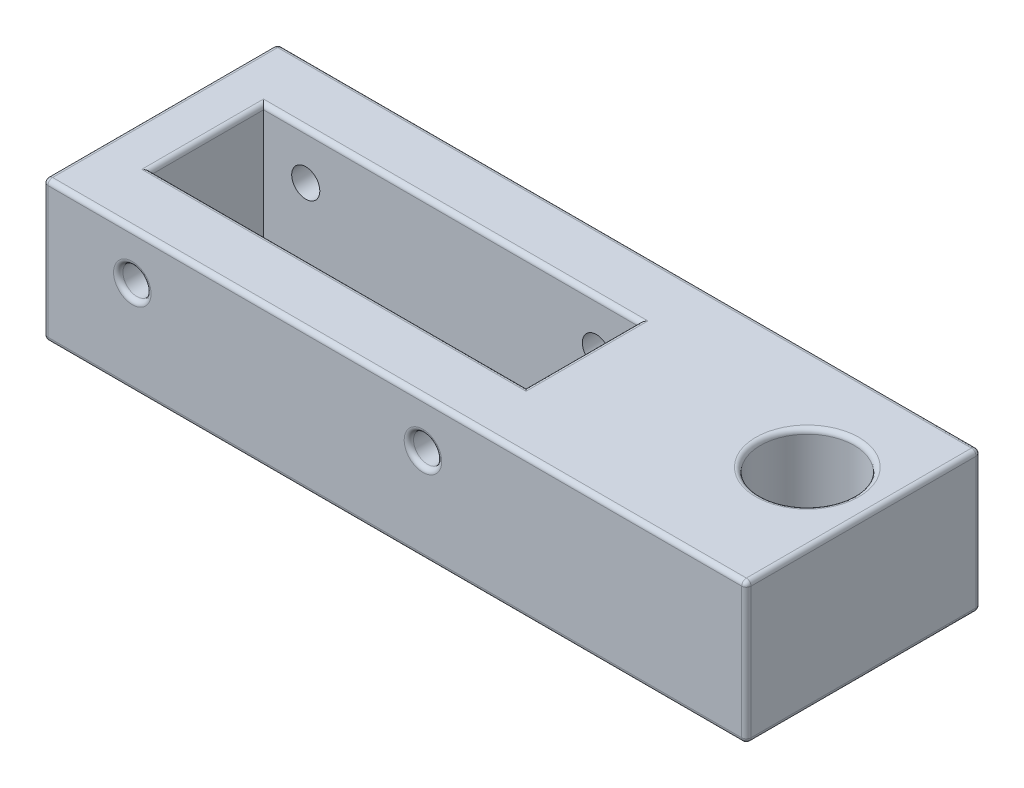
from build123d import *

# Parameters (mm, degrees)
SKETCH1_W               = 1500
SKETCH1_H               = 500
BOSS_EXTRUDE6_DEPTH     = 300
CUT_EXTRUDE3_DEPTH      = 951
CUT_EXTRUDE3_DEPTH_BACK = 951
SKETCH4_R               = 30
FILLET1_R               = 10
FILLET3_R               = 10
FILLET4_R               = 10
FILLET5_R               = 10
FILLET6_R               = 10
FILLET7_R               = 10
CUT_EXTRUDE6_DEPTH      = 846.576726294
CUT_EXTRUDE6_DEPTH_BACK = 846.576726294
SKETCH6_R               = 100
SKETCH6_W               = 800
SKETCH6_H               = 240
FILLET8_R               = 10
FILLET9_R               = 10


with BuildPart() as part:
    # Sketch1 → Boss-Extrude6 (new body)
    with BuildSketch(Plane(origin=(0, 0, 0), x_dir=(1, 0, 0), z_dir=(0, 1, 0))):
        Rectangle(SKETCH1_W, SKETCH1_H)
    extrude(amount=BOSS_EXTRUDE6_DEPTH)

    # Sketch4 → Cut-Extrude3 (cut, two sides: drawn at the far end of the back side and taken through both)
    with BuildSketch(Plane.XY.offset(250).offset(-CUT_EXTRUDE3_DEPTH_BACK)):
        with Locations((-560, 200)):
            Circle(SKETCH4_R)
        with Locations((60, 200)):
            Circle(SKETCH4_R)
    extrude(amount=CUT_EXTRUDE3_DEPTH + CUT_EXTRUDE3_DEPTH_BACK, mode=Mode.SUBTRACT)

    # Fillet1
    fillet1_edges = [part.edges().sort_by_distance(p)[0] for p in [
        (0, 0, -250),
        (750, 0, 0),
        (0, 0, 250),
        (-750, 0, 0),
    ]]
    fillet(fillet1_edges, radius=FILLET1_R)

    # Fillet3
    # the kernel refuses this fillet: 10 mm, written as the material it takes off along each edge
    with BuildSketch(Plane(origin=(-740, 10, -240), x_dir=(-1, 0, 0), z_dir=(0, 0, -1))) as fillet3_piece_1_section:
        Polygon((0, 0), (FILLET3_R, 0), (FILLET3_R, -FILLET3_R), (0, -FILLET3_R), align=None)
    fillet3_piece_1 = extrude(amount=FILLET3_R, mode=Mode.PRIVATE)
    fillet3_piece_1 = fillet3_piece_1 - Plane(origin=(-740, 10, -240), x_dir=(0.7071067811865475, 0.7071067811865475, 0), z_dir=(0, 0, -1)) * Sphere(FILLET3_R, mode=Mode.PRIVATE)
    add(fillet3_piece_1, mode=Mode.SUBTRACT)
    with BuildSketch(Plane(origin=(740, 10, -240), x_dir=(1, 0, 0), z_dir=(0, 0, -1))) as fillet3_piece_2_section:
        Polygon((0, 0), (FILLET3_R, 0), (FILLET3_R, FILLET3_R), (0, FILLET3_R), align=None)
    fillet3_piece_2 = extrude(amount=FILLET3_R, mode=Mode.PRIVATE)
    fillet3_piece_2 = fillet3_piece_2 - Plane(origin=(740, 10, -240), x_dir=(-0.7071067811865475, 0.7071067811865475, 0), z_dir=(0, 0, -1)) * Sphere(FILLET3_R, mode=Mode.PRIVATE)
    add(fillet3_piece_2, mode=Mode.SUBTRACT)
    with BuildSketch(Plane(origin=(775, 300, -250), x_dir=(0, -1, 0), z_dir=(-1, 0, 0))) as fillet3_piece_3:
        with BuildLine():
            CenterArc((FILLET3_R, FILLET3_R), FILLET3_R, 180, 90)
            Line((0, FILLET3_R), (0, 0))
            Line((0, 0), (FILLET3_R, 0))
        make_face()
    extrude(amount=1550, mode=Mode.SUBTRACT)
    with BuildSketch(Plane(origin=(-750, 10, -250), x_dir=(1, 0, 0), z_dir=(0, 1, 0))) as fillet3_piece_4:
        with BuildLine():
            CenterArc((FILLET3_R, -FILLET3_R), FILLET3_R, 90, 90)
            Line((0, -FILLET3_R), (0, 0))
            Line((0, 0), (FILLET3_R, 0))
        make_face()
    extrude(amount=315, mode=Mode.SUBTRACT)
    with BuildSketch(Plane(origin=(750, 10, -250), x_dir=(-1, 0, 0), z_dir=(0, 1, 0))) as fillet3_piece_5:
        with BuildLine():
            CenterArc((FILLET3_R, FILLET3_R), FILLET3_R, 180, 90)
            Line((0, FILLET3_R), (0, 0))
            Line((0, 0), (FILLET3_R, 0))
        make_face()
    extrude(amount=315, mode=Mode.SUBTRACT)

    # Fillet4
    fillet4_edges = [part.edges().sort_by_distance(p)[0] for p in [
        (-590, 200, -250),
        (30, 200, -250),
    ]]
    fillet(fillet4_edges, radius=FILLET4_R)

    # Fillet5
    fillet5_edges = [part.edges().sort_by_distance(p)[0] for p in [
        (-590, 200, 250),
        (30, 200, 250),
    ]]
    fillet(fillet5_edges, radius=FILLET5_R)

    # Fillet6
    # the kernel refuses this fillet: 10 mm, written as the material it takes off along each edge
    with BuildSketch(Plane(origin=(-740, 10, 240), x_dir=(-1, 0, 0), z_dir=(0, 0, 1))) as fillet6_piece_1_section:
        Polygon((0, 0), (FILLET6_R, 0), (FILLET6_R, FILLET6_R), (0, FILLET6_R), align=None)
    fillet6_piece_1 = extrude(amount=FILLET6_R, mode=Mode.PRIVATE)
    fillet6_piece_1 = fillet6_piece_1 - Plane(origin=(-740, 10, 240), x_dir=(0.7071067811865475, 0.7071067811865475, 0), z_dir=(0, 0, 1)) * Sphere(FILLET6_R, mode=Mode.PRIVATE)
    add(fillet6_piece_1, mode=Mode.SUBTRACT)
    with BuildSketch(Plane(origin=(740, 10, 240), x_dir=(1, 0, 0), z_dir=(0, 0, 1))) as fillet6_piece_2_section:
        Polygon((0, 0), (FILLET6_R, 0), (FILLET6_R, -FILLET6_R), (0, -FILLET6_R), align=None)
    fillet6_piece_2 = extrude(amount=FILLET6_R, mode=Mode.PRIVATE)
    fillet6_piece_2 = fillet6_piece_2 - Plane(origin=(740, 10, 240), x_dir=(-0.7071067811865475, 0.7071067811865475, 0), z_dir=(0, 0, 1)) * Sphere(FILLET6_R, mode=Mode.PRIVATE)
    add(fillet6_piece_2, mode=Mode.SUBTRACT)
    with BuildSketch(Plane(origin=(750, 10, 250), x_dir=(-1, 0, 0), z_dir=(0, 1, 0))) as fillet6_piece_3:
        with BuildLine():
            CenterArc((FILLET6_R, -FILLET6_R), FILLET6_R, 90, 90)
            Line((0, -FILLET6_R), (0, 0))
            Line((0, 0), (FILLET6_R, 0))
        make_face()
    extrude(amount=315, mode=Mode.SUBTRACT)
    with BuildSketch(Plane(origin=(-750, 10, 250), x_dir=(1, 0, 0), z_dir=(0, 1, 0))) as fillet6_piece_4:
        with BuildLine():
            CenterArc((FILLET6_R, FILLET6_R), FILLET6_R, 180, 90)
            Line((0, FILLET6_R), (0, 0))
            Line((0, 0), (FILLET6_R, 0))
        make_face()
    extrude(amount=315, mode=Mode.SUBTRACT)
    with BuildSketch(Plane(origin=(-775, 300, 250), x_dir=(0, -1, 0), z_dir=(1, 0, 0))) as fillet6_piece_5:
        with BuildLine():
            CenterArc((FILLET6_R, FILLET6_R), FILLET6_R, 180, 90)
            Line((0, FILLET6_R), (0, 0))
            Line((0, 0), (FILLET6_R, 0))
        make_face()
    extrude(amount=1550, mode=Mode.SUBTRACT)

    # Fillet7
    # the kernel refuses this fillet: 10 mm, written as the material it takes off along each edge
    with BuildSketch(Plane(origin=(740, 290, -240), x_dir=(0, 1, 0), z_dir=(1, 0, 0))) as fillet7_piece_1_section:
        Polygon((0, 0), (FILLET7_R, 0), (FILLET7_R, -FILLET7_R), (0, -FILLET7_R), align=None)
    fillet7_piece_1 = extrude(amount=FILLET7_R, mode=Mode.PRIVATE)
    fillet7_piece_1 = fillet7_piece_1 - Plane(origin=(740, 290, -240), x_dir=(0, -0.7071067811865475, 0.7071067811865475), z_dir=(1, 0, 0)) * Sphere(FILLET7_R, mode=Mode.PRIVATE)
    add(fillet7_piece_1, mode=Mode.SUBTRACT)
    with BuildSketch(Plane(origin=(-740, 290, -240), x_dir=(-1, 0, 0), z_dir=(0, 1, 0))) as fillet7_piece_2_section:
        Polygon((0, 0), (FILLET7_R, 0), (FILLET7_R, -FILLET7_R), (0, -FILLET7_R), align=None)
    fillet7_piece_2 = extrude(amount=FILLET7_R, mode=Mode.PRIVATE)
    fillet7_piece_2 = fillet7_piece_2 - Plane(origin=(-740, 290, -240), x_dir=(0.7071067811865477, 0, 0.7071067811865475), z_dir=(0, 1, 0)) * Sphere(FILLET7_R, mode=Mode.PRIVATE)
    add(fillet7_piece_2, mode=Mode.SUBTRACT)
    with BuildSketch(Plane(origin=(-740, 290, 240), x_dir=(-1, 0, 0), z_dir=(0, 1, 0))) as fillet7_piece_3_section:
        Polygon((0, 0), (FILLET7_R, 0), (FILLET7_R, FILLET7_R), (0, FILLET7_R), align=None)
    fillet7_piece_3 = extrude(amount=FILLET7_R, mode=Mode.PRIVATE)
    fillet7_piece_3 = fillet7_piece_3 - Plane(origin=(-740, 290, 240), x_dir=(0.7071067811865475, 0, -0.7071067811865476), z_dir=(0, 1, 0)) * Sphere(FILLET7_R, mode=Mode.PRIVATE)
    add(fillet7_piece_3, mode=Mode.SUBTRACT)
    with BuildSketch(Plane(origin=(740, 290, 240), x_dir=(0, 1, 0), z_dir=(1, 0, 0))) as fillet7_piece_4_section:
        Polygon((0, 0), (FILLET7_R, 0), (FILLET7_R, FILLET7_R), (0, FILLET7_R), align=None)
    fillet7_piece_4 = extrude(amount=FILLET7_R, mode=Mode.PRIVATE)
    fillet7_piece_4 = fillet7_piece_4 - Plane(origin=(740, 290, 240), x_dir=(0, -0.7071067811865475, -0.7071067811865475), z_dir=(1, 0, 0)) * Sphere(FILLET7_R, mode=Mode.PRIVATE)
    add(fillet7_piece_4, mode=Mode.SUBTRACT)
    with BuildSketch(Plane(origin=(-750, 300, -240), x_dir=(1, 0, 0), z_dir=(0, 0, 1))) as fillet7_piece_5:
        with BuildLine():
            CenterArc((FILLET7_R, -FILLET7_R), FILLET7_R, 90, 90)
            Line((0, -FILLET7_R), (0, 0))
            Line((0, 0), (FILLET7_R, 0))
        make_face()
    extrude(amount=480, mode=Mode.SUBTRACT)
    with BuildSketch(Plane(origin=(750, 300, 240), x_dir=(0, -1, 0), z_dir=(0, 0, -1))) as fillet7_piece_6:
        with BuildLine():
            CenterArc((FILLET7_R, FILLET7_R), FILLET7_R, 180, 90)
            Line((0, FILLET7_R), (0, 0))
            Line((0, 0), (FILLET7_R, 0))
        make_face()
    extrude(amount=480, mode=Mode.SUBTRACT)

    # Sketch6 → Cut-Extrude6 (cut, two sides: drawn at the far end of the back side and taken through both)
    with BuildSketch(Plane(origin=(0, 300, 0), x_dir=(1, 0, 0), z_dir=(0, 1, 0)).offset(-CUT_EXTRUDE6_DEPTH_BACK)):
        with Locations(Location((600, 30, 0), (0, 0, 270))):
            Circle(SKETCH6_R)
        with Locations((-250, 0)):
            Rectangle(SKETCH6_W, SKETCH6_H)
    extrude(amount=CUT_EXTRUDE6_DEPTH + CUT_EXTRUDE6_DEPTH_BACK, mode=Mode.SUBTRACT)

    # Fillet8
    fillet8_edges = [part.edges().sort_by_distance(p)[0] for p in [
        (600, 300, -130),
        (-650, 300, 0),
        (-250, 300, -120),
        (-250, 300, 120),
        (150, 300, 0),
    ]]
    fillet(fillet8_edges, radius=FILLET8_R)

    # Fillet9
    fillet9_edges = [part.edges().sort_by_distance(p)[0] for p in [
        (600, 0, -130),
        (-650, 0, 0),
        (-250, 0, 120),
        (-250, 0, -120),
        (150, 0, 0),
    ]]
    fillet(fillet9_edges, radius=FILLET9_R)


solid = part.part
